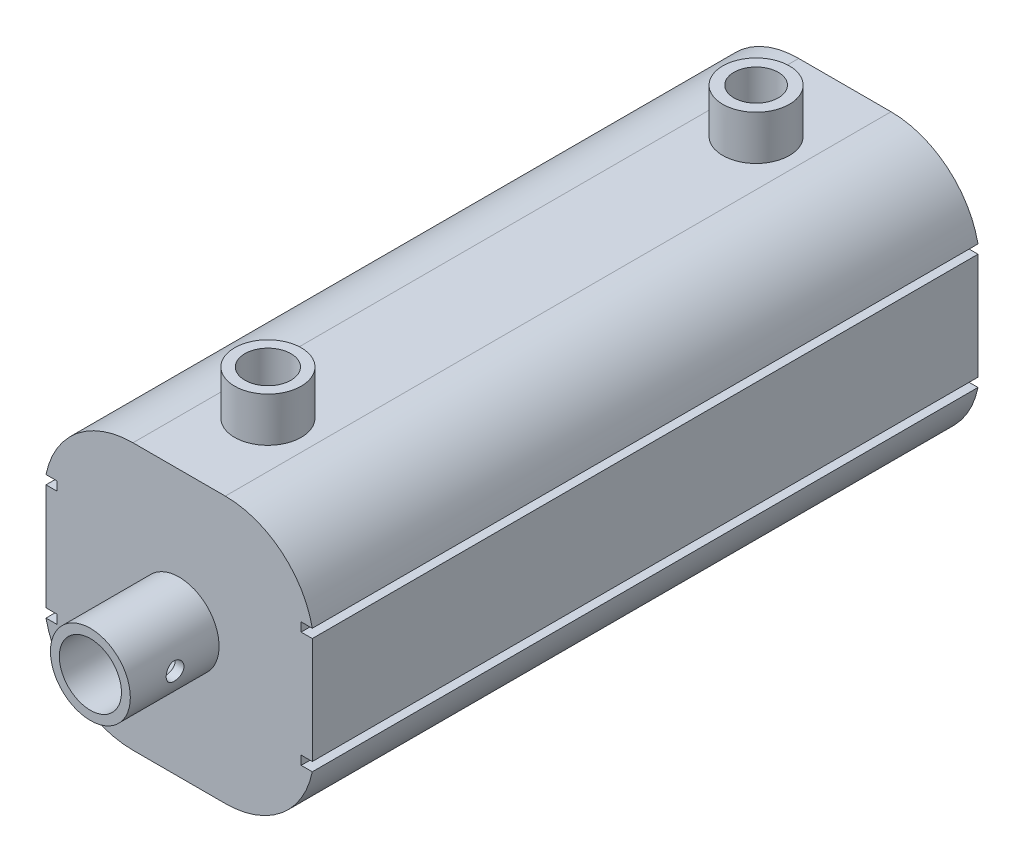
from build123d import *

# Parameters (mm, degrees)
SKETCH1_W           = 75
SKETCH1_H           = 30
BOSS_EXTRUDE1_DEPTH = 30
SKETCH3_R           = 5
CUT_EXTRUDE1_DEPTH  = 60
SKETCH4_W           = 1.254965376
SKETCH4_H           = 1
CUT_EXTRUDE2_DEPTH  = 83.158383626
SKETCH5_R           = 2.5
SKETCH5_R_2         = 2.597055459
CUT_EXTRUDE3_DEPTH  = 20
BOSS_EXTRUDE2_START = 5
SKETCH6_R           = 3.75
SKETCH6_R_2         = 2.597055459
SKETCH6_R_3         = 2.5
BOSS_EXTRUDE2_DEPTH = 5
SKETCH7_R           = 2.5
CUT_EXTRUDE4_DEPTH  = 10
SKETCH8_R           = 4.5
SKETCH8_R_2         = 3.5
BOSS_EXTRUDE3_DEPTH = 10
SKETCH9_R           = 1
CUT_EXTRUDE5_DEPTH  = 60.634302243
FILLET1_R           = 10


with BuildPart() as part:
    # Sketch1 → Boss-Extrude1 (new body)
    with BuildSketch(Plane(origin=(0, 0, 0), x_dir=(0, 0, -1), z_dir=(1, 0, 0))):
        Rectangle(SKETCH1_W, SKETCH1_H)
    extrude(amount=BOSS_EXTRUDE1_DEPTH)

    # Sketch3 → Cut-Extrude1 (cut)
    with BuildSketch(Plane(origin=(0, 0, -37.5), x_dir=(-1, 0, 0), z_dir=(0, 0, -1))):
        with Locations((-15, 0)):
            Circle(SKETCH3_R)
    extrude(amount=-CUT_EXTRUDE1_DEPTH, mode=Mode.SUBTRACT)

    # Sketch4 → Cut-Extrude2 (cut, through all)
    with BuildSketch(Plane(origin=(0, 0, -37.5), x_dir=(-1, 0, 0), z_dir=(0, 0, -1))):
        with Locations((-29.372517312, 6.5)):
            Rectangle(SKETCH4_W, SKETCH4_H)
        with Locations((-29.372517312, -6.5)):
            Rectangle(SKETCH4_W, SKETCH4_H)
        with Locations((-0.627482688, -6.5)):
            Rectangle(SKETCH4_W, SKETCH4_H)
        with Locations((-0.627482688, 6.5)):
            Rectangle(SKETCH4_W, SKETCH4_H)
    extrude(amount=-CUT_EXTRUDE2_DEPTH, mode=Mode.SUBTRACT)

    # Sketch5 → Cut-Extrude3 (cut)
    with BuildSketch(Plane(origin=(0, 15, 0), x_dir=(1, 0, 0), z_dir=(0, 1, 0))):
        with Locations(Location((15, 27.5, 0), (0, 0, 270))):
            Circle(SKETCH5_R)
        with Locations(Location((15, -27.5, 0), (0, 0, 270))):
            Circle(SKETCH5_R_2)
    extrude(amount=-CUT_EXTRUDE3_DEPTH, mode=Mode.SUBTRACT)

    # Sketch6 → Boss-Extrude2 (add)
    # profile 1 of 2: a face of its own
    with BuildSketch(Plane(origin=(0, 15, 0), x_dir=(1, 0, 0), z_dir=(0, 1, 0)).offset(BOSS_EXTRUDE2_START)):
        with Locations(Location((15, -27.5, 0), (0, 0, 90))):
            Circle(SKETCH6_R)
        with Locations(Location((15, -27.5, 0), (0, 0, 270))):
            Circle(SKETCH6_R_2, mode=Mode.SUBTRACT)
    # profile 2 of 2: a face of its own
    with BuildSketch(Plane(origin=(0, 15, 0), x_dir=(1, 0, 0), z_dir=(0, 1, 0)).offset(BOSS_EXTRUDE2_START)):
        with Locations(Location((15, 27.5, 0), (0, 0, 90))):
            Circle(SKETCH6_R)
        with Locations(Location((15, 27.5, 0), (0, 0, 270))):
            Circle(SKETCH6_R_3, mode=Mode.SUBTRACT)
    extrude(amount=-BOSS_EXTRUDE2_DEPTH)

    # Sketch7 → Cut-Extrude4 (cut)
    with BuildSketch(Plane(origin=(0, 0, 22.5), x_dir=(-1, 0, 0), z_dir=(0, 0, -1))):
        with Locations((-15, 0)):
            Circle(SKETCH7_R)
    extrude(amount=-CUT_EXTRUDE4_DEPTH, mode=Mode.SUBTRACT)

    # Sketch8 → Boss-Extrude3 (add)
    with BuildSketch(Plane.XY.offset(37.5)):
        with Locations(Location((15, 0, 0), (0, 0, 180))):
            Circle(SKETCH8_R)
        with Locations((15, 0)):
            Circle(SKETCH8_R_2, mode=Mode.SUBTRACT)
    extrude(amount=BOSS_EXTRUDE3_DEPTH)

    # Sketch9 → Cut-Extrude5 (cut, through all)
    with BuildSketch(Plane(origin=(0, 0, 0), x_dir=(0, 0, -1), z_dir=(1, 0, 0))):
        with Locations(Location((-42.457775401, 0, 0), (0, 0, 180))):
            Circle(SKETCH9_R)
    extrude(amount=CUT_EXTRUDE5_DEPTH, mode=Mode.SUBTRACT)

    # Fillet1
    # the kernel refuses this fillet: 10 mm, written as the material it takes off along each edge
    with BuildSketch(Plane(origin=(30, -15, 61.994897428), x_dir=(-1, 0, 0), z_dir=(0, 0, -1)), Plane(origin=(30, 15, -61.994897428), x_dir=(-1, 0, 0), z_dir=(0, 0, 1))) as fillet1_piece_1:
        with BuildLine():
            CenterArc((9.797958971, 10), FILLET1_R, 191.536959033, 78.463040967)
            Line((0, 8), (-0.195959179, 7.96))
            ThreePointArc((-0.195959179, 7.96), (-0.2, 4), (-0.2, 0))
            Line((-0.2, 0), (0, -0.2))
            Line((0, -0.2), (9.797958971, -0.2))
            Line((9.797958971, -0.2), (9.797958971, 0))
        make_face()
    extrude(amount=123.989794856, mode=Mode.SUBTRACT)
    with BuildSketch(Plane(origin=(0, -15, 61.994897428), x_dir=(1, 0, 0), z_dir=(0, 0, -1))) as fillet1_piece_2:
        with BuildLine():
            CenterArc((9.797958971, -10), FILLET1_R, 90, 78.463040967)
            Line((0, -8), (-0.195959179, -7.96))
            ThreePointArc((-0.195959179, -7.96), (-0.2, -4), (-0.2, 0))
            Line((-0.2, 0), (0, 0.2))
            Line((0, 0.2), (9.797958971, 0.2))
            Line((9.797958971, 0.2), (9.797958971, 0))
        make_face()
    extrude(amount=123.989794856, mode=Mode.SUBTRACT)
    with BuildSketch(Plane(origin=(0, 15, -61.994897428), x_dir=(0, -1, 0), z_dir=(0, 0, 1))) as fillet1_piece_3:
        with BuildLine():
            CenterArc((10, 9.797958971), FILLET1_R, 180, 78.463040967)
            Line((0, 9.797958971), (-0.2, 9.797958971))
            Line((-0.2, 9.797958971), (-0.2, 0))
            Line((-0.2, 0), (0, -0.2))
            ThreePointArc((0, -0.2), (4, -0.2), (7.96, -0.195959179))
            Line((7.96, -0.195959179), (8, 0))
        make_face()
    extrude(amount=123.989794856, mode=Mode.SUBTRACT)


solid = part.part
